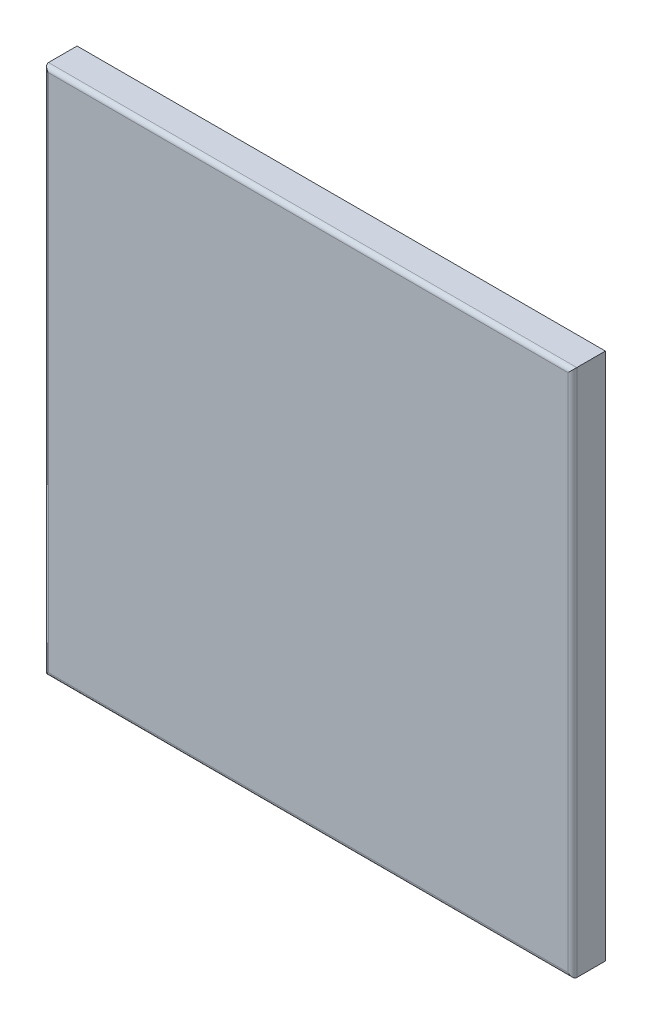
from build123d import *

# Parameters (mm, degrees)
SKETCH1_W           = 304.8
SKETCH1_H           = 304.8
BOSS_EXTRUDE1_DEPTH = 2.54
SKETCH2_W           = 304.8
SKETCH2_H           = 304.8
SKETCH2_W_2         = 299.72
SKETCH2_H_2         = 299.72
BOSS_EXTRUDE2_DEPTH = 19.05
FILLET1_R           = 2.54


with BuildPart() as part:
    # Sketch1 → Boss-Extrude1 (new body)
    with BuildSketch(Plane.XY):
        Rectangle(SKETCH1_W, SKETCH1_H)
    extrude(amount=BOSS_EXTRUDE1_DEPTH)

    # Sketch2 → Boss-Extrude2 (add)
    with BuildSketch(Plane.XY.offset(2.54)):
        Rectangle(SKETCH2_W, SKETCH2_H)
        Rectangle(SKETCH2_W_2, SKETCH2_H_2, mode=Mode.SUBTRACT)
    extrude(amount=-BOSS_EXTRUDE2_DEPTH)

    # Fillet1
    fillet1_edges = [part.edges().sort_by_distance(p)[0] for p in [
        (-152.4, 0, 2.54),
        (0, -152.4, 2.54),
        (0, -149.86, -16.51),
        (152.4, 0, 2.54),
        (0, 152.4, 2.54),
    ]]
    fillet(fillet1_edges, radius=FILLET1_R - 0.0001)  # a hair under: the kernel refuses the full size


solid = part.part
